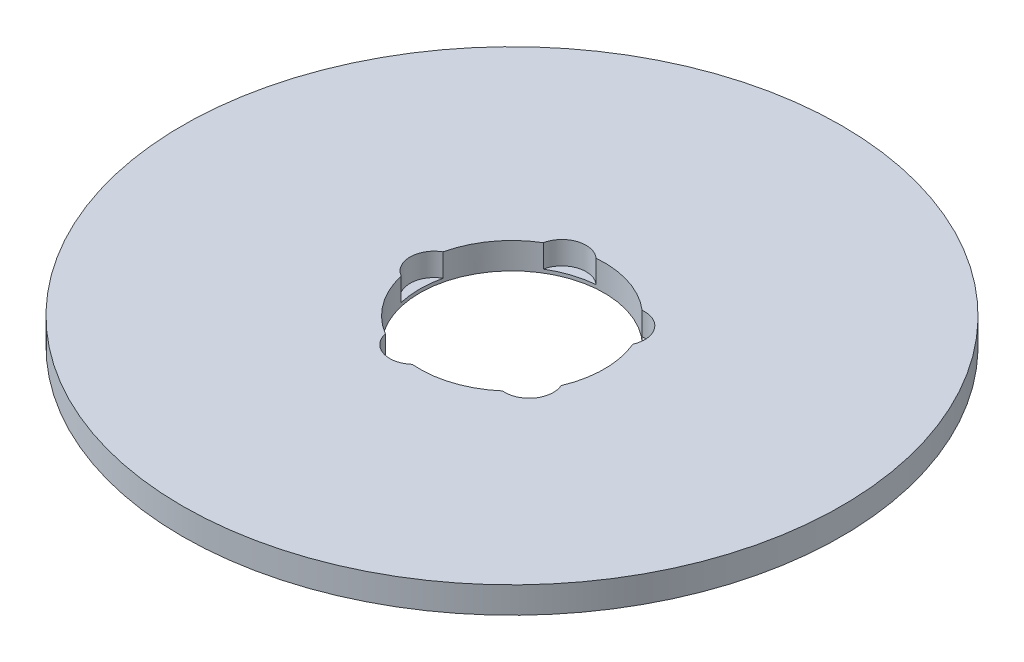
from build123d import *

# Parameters (mm, degrees)
SKETCH1_R           = 62.5
BOSS_EXTRUDE1_DEPTH = 5
SKETCH2_R           = 17.5
CUT_EXTRUDE1_DEPTH  = 89.529656048
SKETCH3_R           = 4.585663962
CUT_EXTRUDE2_DEPTH  = 4.343948076
CIRPATTERN1_COUNT   = 5


with BuildPart() as part:
    # Sketch1 → Boss-Extrude1 (new body)
    with BuildSketch(Plane(origin=(0, 0, 0), x_dir=(1, 0, 0), z_dir=(0, 1, 0))):
        Circle(SKETCH1_R)
    extrude(amount=BOSS_EXTRUDE1_DEPTH)

    # Sketch2 → Cut-Extrude1 (cut, through all)
    with BuildSketch(Plane(origin=(0, 0, 0), x_dir=(1, 0, 0), z_dir=(0, 1, 0))):
        Circle(SKETCH2_R)
    extrude(amount=CUT_EXTRUDE1_DEPTH, mode=Mode.SUBTRACT)

    # Sketch3 → Cut-Extrude2 (cut)
    with BuildSketch(Plane(origin=(0, 5, 0), x_dir=(1, 0, 0), z_dir=(0, 1, 0))):
        with Locations((-14.749666425, 0)):
            Circle(SKETCH3_R)
    cut_extrude2 = extrude(amount=-CUT_EXTRUDE2_DEPTH, mode=Mode.SUBTRACT)

    # CirPattern1: Cut-Extrude2 ×5 about axis
    cirpattern1_axis = Axis((0, 0, 0), (0, 1, 0))
    for i in range(1, CIRPATTERN1_COUNT):
        add(cut_extrude2.rotate(cirpattern1_axis, i * 360 / CIRPATTERN1_COUNT), mode=Mode.SUBTRACT)


solid = part.part
